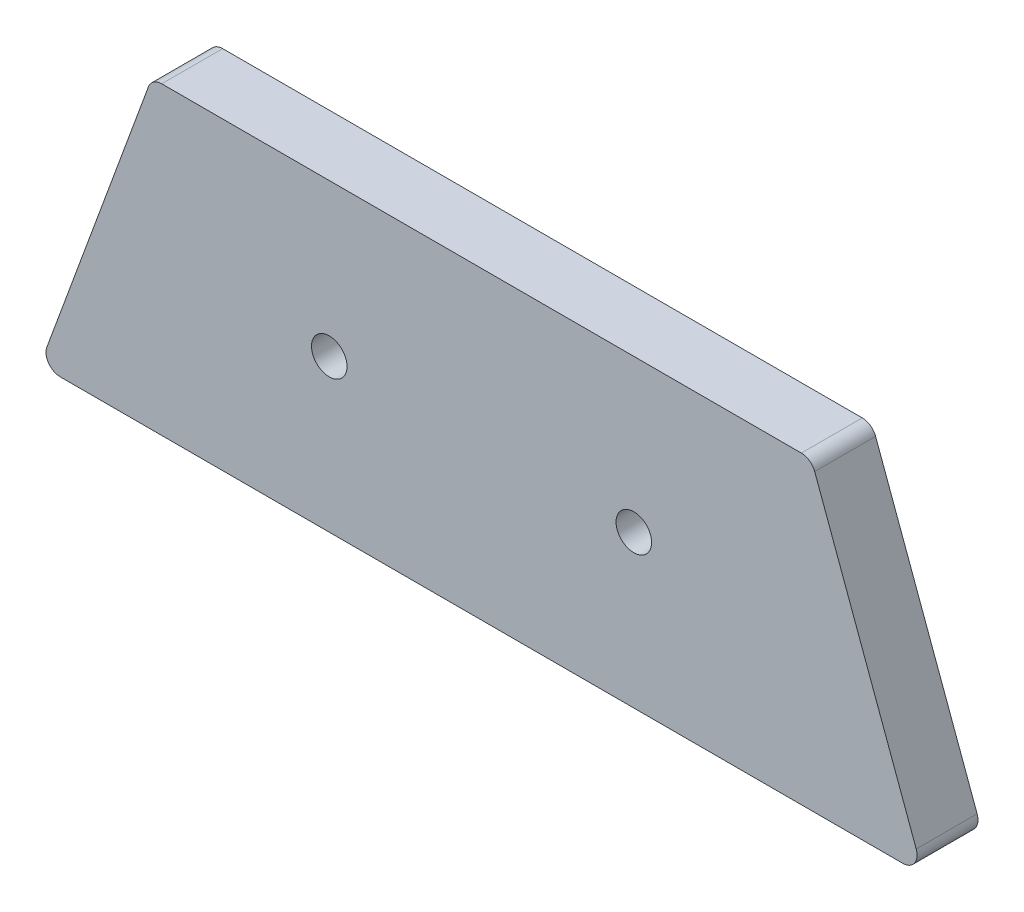
from build123d import *

# Parameters (mm, degrees)
SKETCH2_R           = 2.2225
BOSS_EXTRUDE1_DEPTH = 7.62


with BuildPart() as part:
    # Sketch2 → Boss-Extrude1 (new body)
    with BuildSketch(Plane.XY):
        with BuildLine():
            Line((40.005, 34.194483756), (-40.005, 34.194483756))
            ThreePointArc((-40.005, 34.194483756), (-41.022456018, 33.874587748), (-41.673792668, 33.030010472))
            Line((-41.673792668, 33.030010472), (-54.373792668, -1.513989528))
            ThreePointArc((-54.373792668, -1.513989528), (-54.163103992, -3.144972262), (-52.705, -3.905516244))
            Line((-52.705, -3.905516244), (52.705, -3.905516244))
            ThreePointArc((52.705, -3.905516244), (54.163103992, -3.144972262), (54.373792668, -1.513989528))
            Line((54.373792668, -1.513989528), (41.673792668, 33.030010472))
            ThreePointArc((41.673792668, 33.030010472), (41.022456018, 33.874587748), (40.005, 34.194483756))
        make_face()
        with Locations((-19.05, 15.144483756)):
            Circle(SKETCH2_R, mode=Mode.SUBTRACT)
        with Locations((19.05, 15.144483756)):
            Circle(SKETCH2_R, mode=Mode.SUBTRACT)
    extrude(amount=BOSS_EXTRUDE1_DEPTH)


solid = part.part
